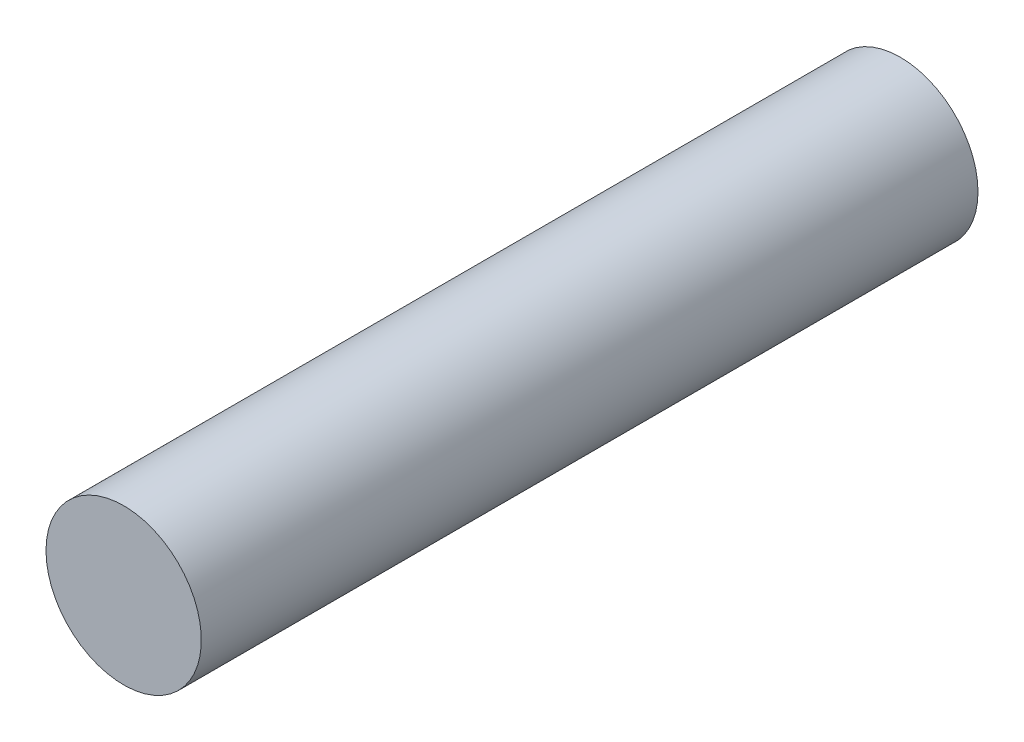
from build123d import *

# Parameters (mm, degrees)
SKETCH2_R           = 7.62
BOSS_EXTRUDE1_DEPTH = 76.2


with BuildPart() as part:
    # Sketch2 → Boss-Extrude1 (new body)
    with BuildSketch(Plane.XY):
        Circle(SKETCH2_R)
    extrude(amount=BOSS_EXTRUDE1_DEPTH)

    # Sketch7 → Revolve1 (revolve)
    with BuildSketch(Plane(origin=(0, 0, 0), x_dir=(1, 0, 0), z_dir=(0, 1, 0))):
        with BuildLine():
            Line((0, 0), (0, 2.539336382))
            ThreePointArc((0, 2.539336382), (4.015987714, 1.887792827), (7.62, 0))
            Line((7.62, 0), (0, 0))
        make_face()
    revolve(axis=Axis((0, 0, 0), (0, 0, -1)))


solid = part.part
